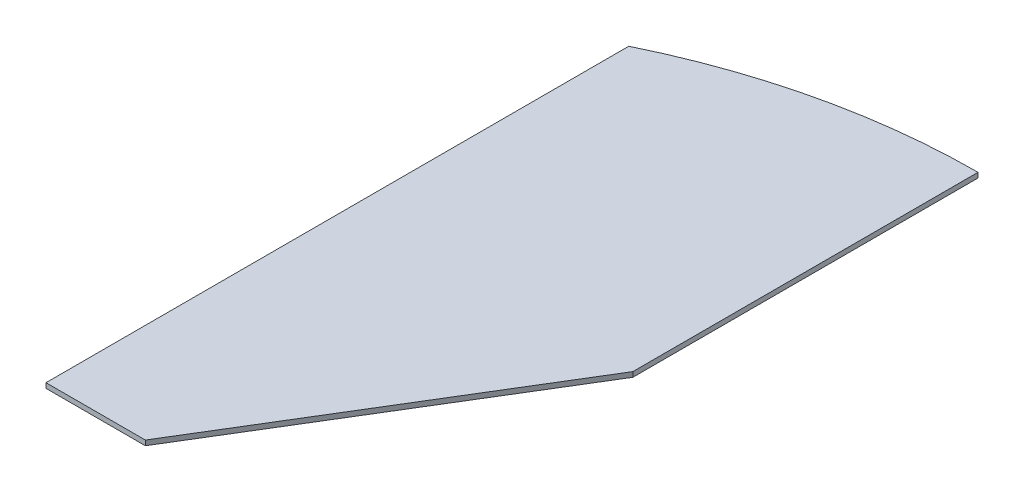
from build123d import *

# Parameters (mm, degrees)
BOSS_EXTRUDE1_DEPTH = 0.35
SCALE1_SCALE        = 10


with BuildPart() as part:
    # Sketch1 → Boss-Extrude1 (new body)
    with BuildSketch(Plane(origin=(0, 0, 0), x_dir=(1, 0, 0), z_dir=(0, 1, 0))):
        with BuildLine():
            Line((-0.845785748, -19.220149774), (12.154214252, 2.13400673))
            Line((12.154214252, 2.13400673), (12.154214252, 26.456928478))
            ThreePointArc((12.154214252, 26.456928478), (1.891851134, 25.289168137), (-7.845785748, 21.84559602))
            Line((-7.845785748, 21.84559602), (-7.845785748, -19.220149774))
            Line((-7.845785748, -19.220149774), (-0.845785748, -19.220149774))
        make_face()
    extrude(amount=BOSS_EXTRUDE1_DEPTH)


with BuildPart() as part_1:
    # Scale1: scaled about (1.302109207, 0.175, -5.681101669)
    add(part.part.scale(SCALE1_SCALE).moved(Location((-11.718982863, -1.575, 51.129915021))))


solid = part_1.part
